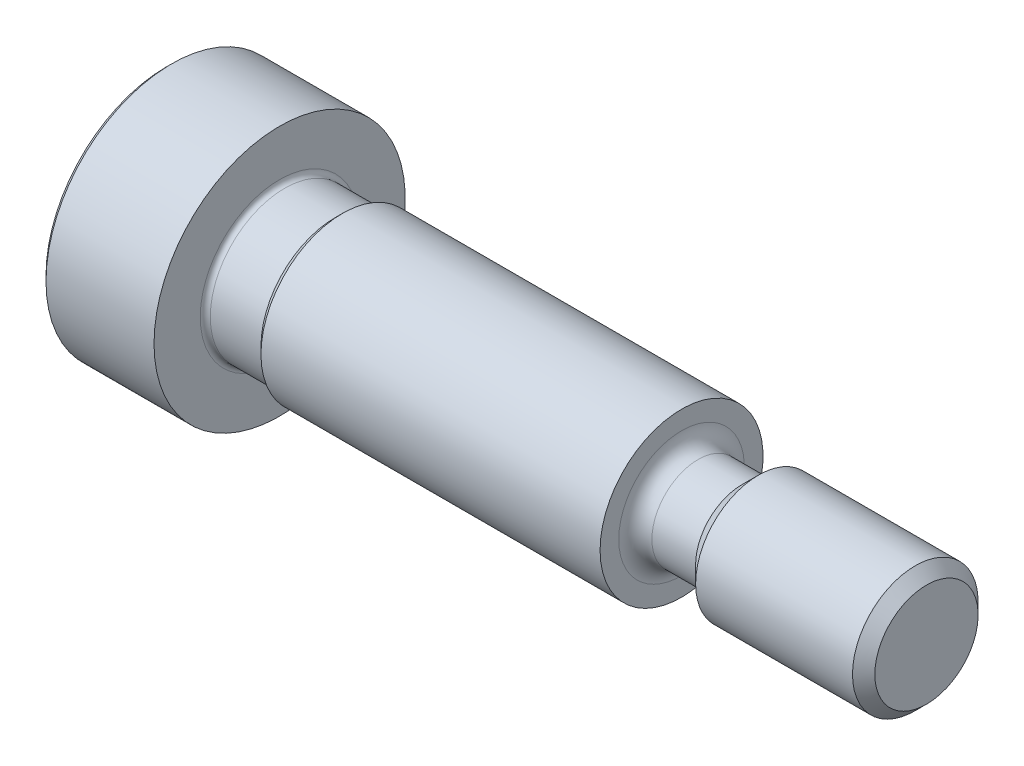
from build123d import *

# Parameters (mm, degrees)
CHAMFER1_SIZE = 0.2
HEX_2_DEPTH   = 2.4


# Read off the part's stored shape, not the designer's step: ThreadSchematic
with BuildPart() as part:
    # ThreadSchematic outline → ThreadSchematic (revolve)
    with BuildSketch(Plane.YX):
        with BuildLine():
            Line((0, 30.25), (0, 0))
            Line((0, 0), (5, 0))
            Line((5, 0), (5, 4.5))
            Line((5, 4.5), (3.16, 4.5))
            ThreePointArc((3.16, 4.5), (3.018578644, 4.558578644), (2.96, 4.7))
            Line((2.96, 4.7), (2.96, 6.7165))
            Line((2.96, 6.7165), (3.2435, 7))
            Line((3.2435, 7), (3.2435, 20.5))
            Line((3.2435, 20.5), (2.5, 20.5))
            ThreePointArc((2.5, 20.5), (2.033309524, 20.693309524), (1.84, 21.16))
            Line((1.84, 21.16), (1.84, 22.9))
            Line((1.84, 22.9), (2.5, 23.56))
            Line((2.5, 23.56), (2.5, 29.805))
            Line((2.5, 29.805), (2.055, 30.25))
            Line((2.055, 30.25), (0, 30.25))
        make_face()
    revolve(axis=Axis((0, 0, 0), (1, 0, 0)))

    # Chamfer1
    chamfer1_edges = [part.edges().sort_by_distance(p)[0] for p in [
        (0, -5, 0),
    ]]
    chamfer(chamfer1_edges, length=CHAMFER1_SIZE)

    # Sketch2 → PreBroach (revolve, cut)
    with BuildSketch(Plane.XY, mode=Mode.PRIVATE) as prebroach_sk:
        Polygon((0, 1.54), (2.4, 1.54), (3.289119415, 0), (0, 0), align=None)
    revolve(prebroach_sk.sketch.rotate(Axis((0, 0, 0), (1, 0, 0)), 90), axis=Axis((0, 0, 0), (1, 0, 0)), mode=Mode.SUBTRACT)

    # Sketch3 → Hex 2 (cut)
    with BuildSketch(Plane.ZY):
        Polygon((-1.54, -0.889119415), (-1.54, 0.889119415), (0, 1.778238829), (1.54, 0.889119415), (1.54, -0.889119415), (0, -1.778238829), align=None)
    extrude(amount=-HEX_2_DEPTH, mode=Mode.SUBTRACT)


solid = part.part
